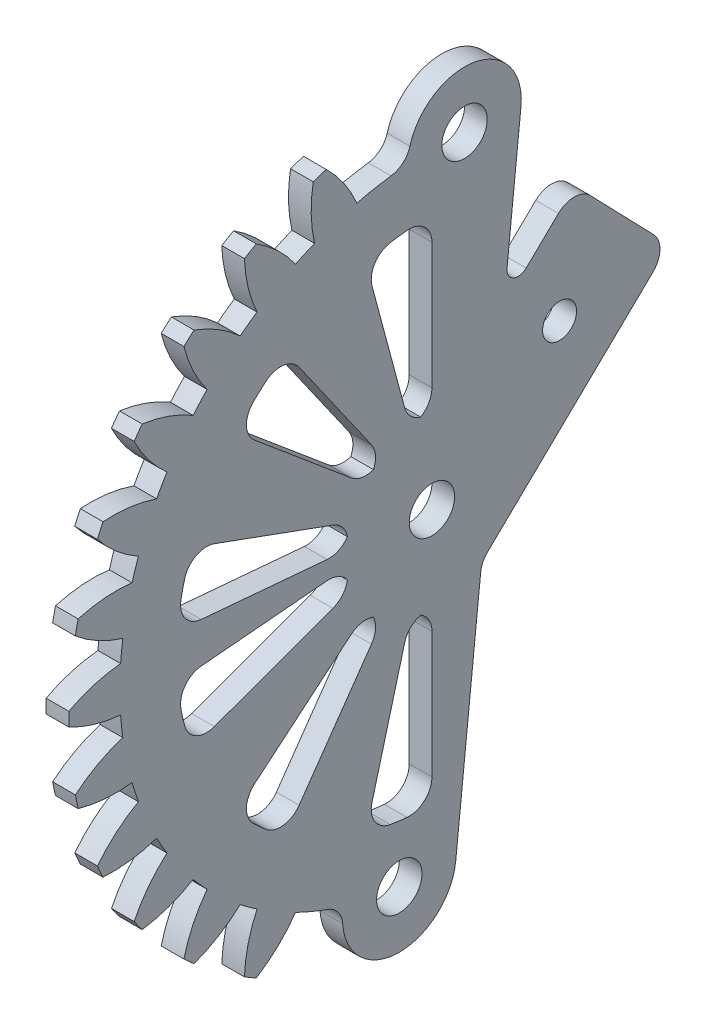
from build123d import *

# Parameters (mm, degrees)
BASPROSKE_W         = 2
BASPROSKE_H         = 32
TOOTHCUT_DEPTH      = 46.299006612
TEETHCUTS_COUNT     = 30
TEETHCUTS_ANGLE     = 348
BORSKE_R            = 0.4
BORE_DEPTH          = 50.0000508
CUT_EXTRUDE_1_DEPTH = 10
CUT_EXTRUDE_3_DEPTH = 46.215730311
EXTRUDE_1_DEPTH     = 2
SKETCH_5_R          = 2
CUT_EXTRUDE_4_DEPTH = 10
EXTRUDE_START       = -2
EXTRUDE_2_DEPTH     = 2
SKETCH_8_R          = 2
CUT_EXTRUDE_6_DEPTH = 2
SKETCH_9_R          = 1.5
EXTRUDE_3_DEPTH     = 2
FILLET_7_R          = 2
CUT_EXTRUDE_7_DEPTH = 10
FILLET_8_R          = 2
FILLET_9_R          = 1


with BuildPart() as part:
    # BasProSke → Base-Revolve (revolve)
    with BuildSketch(Plane(origin=(0, 0, 0), x_dir=(1, 0, 0), z_dir=(0, 1, 0)), mode=Mode.PRIVATE) as base_revolve_sk:
        with Locations((1, 16)):
            Rectangle(BASPROSKE_W, BASPROSKE_H)
    revolve(base_revolve_sk.sketch.rotate(Axis((-10, 0, 0), (1, 0, 0)), 180), axis=Axis((-10, 0, 0), (1, 0, 0)))

    # TooCutSke → ToothCut (cut, through all)
    with BuildSketch(Plane(origin=(0, 0, 0), x_dir=(0, 0, -1), z_dir=(1, 0, 0))):
        with BuildLine():
            ThreePointArc((0.918551563, 27.483654488), (0, 27.499), (-0.918551563, 27.483654488))
            ThreePointArc((-0.918551563, 27.483654488), (-1.617208176, 29.787801627), (-2.761784709, 31.906093311))
            ThreePointArc((-2.761784709, 31.906093311), (0, 32.0254), (2.761784709, 31.906093311))
            ThreePointArc((2.761784709, 31.906093311), (1.617208176, 29.787801627), (0.918551563, 27.483654488))
        make_face()
    toothcut = extrude(amount=TOOTHCUT_DEPTH, mode=Mode.SUBTRACT)

    # TeethCuts: ToothCut ×30 about axis
    teethcuts_axis = Axis((-10, 0, 0), (1, 0, 0))
    for i in range(1, TEETHCUTS_COUNT):
        add(toothcut.rotate(teethcuts_axis, i * TEETHCUTS_ANGLE / (TEETHCUTS_COUNT - 1)), mode=Mode.SUBTRACT)

    # BorSke → Bore (cut, symmetric)
    with BuildSketch(Plane(origin=(0, 0, 0), x_dir=(0, 0, -1), z_dir=(1, 0, 0))):
        with Locations(Location((0, 0, 0), (0, 0, 180))):
            Circle(BORSKE_R)
    extrude(amount=BORE_DEPTH, both=True, mode=Mode.SUBTRACT)

    # 草图1 → 切除-拉伸1 (cut)
    with BuildSketch(Plane(origin=(2, 0, 0), x_dir=(0, 0, -1), z_dir=(1, 0, 0))):
        Polygon((3.344910825, 31.824700652), (-3.960111671, -37.677945718), (64.810502564, -34.553326749), (47.008100667, 53.868547869), (5.993727235, 38.229973826), align=None)
    extrude(amount=-CUT_EXTRUDE_1_DEPTH, mode=Mode.SUBTRACT)

    # 草图2 → 切除-拉伸3 (cut, through all)
    with BuildSketch(Plane(origin=(2, 0, 0), x_dir=(0, 0, -1), z_dir=(1, 0, 0))):
        with BuildLine():
            Line((4.939512658, 27.051732213), (6.979218814, 36.725980442))
            Line((6.979218814, 36.725980442), (-6.447162529, 36.725980442))
            Line((-6.447162529, 36.725980442), (-5.501449664, 26.943070586))
            ThreePointArc((-5.501449664, 26.943070586), (-0.286173264, 27.497510903), (4.939512658, 27.051732213))
        make_face()
        with BuildLine():
            Line((-11.106203944, -25.156455135), (-12.164876938, -35.534369935))
            Line((-12.164876938, -35.534369935), (-0.063712698, -31.064954068))
            Line((-0.063712698, -31.064954068), (0, -27.499))
            ThreePointArc((0, -27.499), (-5.675281546, -26.906991292), (-11.106203944, -25.156455135))
        make_face()
    extrude(amount=-CUT_EXTRUDE_3_DEPTH, mode=Mode.SUBTRACT)

    # 草图4 → 凸台-拉伸1 (add)
    with BuildSketch(Plane(origin=(2, 0, 0), x_dir=(0, 0, -1), z_dir=(1, 0, 0))):
        Polygon((2.874428211, 27.348357601), (-2.874428211, -27.348357601), (2.098181265, -27.870999917), (7.847037688, 26.825715284), align=None)
    extrude(amount=-EXTRUDE_1_DEPTH)

    # 草图5 → 切除-拉伸4 (cut)
    with BuildSketch(Plane(origin=(2, 0, 0), x_dir=(0, 0, -1), z_dir=(1, 0, 0))):
        Circle(SKETCH_5_R)
    extrude(amount=-CUT_EXTRUDE_4_DEPTH, mode=Mode.SUBTRACT)

    # 草图6 → 凸台-拉伸2 (add)
    with BuildSketch(Plane(origin=(2, 0, 0), x_dir=(0, 0, -1), z_dir=(1, 0, 0)).offset(EXTRUDE_START)):
        with BuildLine():
            Line((2.874428211, 27.348357601), (7.847037688, 26.825715284))
            ThreePointArc((7.847037688, 26.825715284), (3.170258871, 32.33959835), (-2.125103827, 27.416763754))
            ThreePointArc((-2.125103827, 27.416763754), (0.37622016, 27.496426302), (2.874428211, 27.348357601))
        make_face()
        with BuildLine():
            Line((-2.874428211, -27.348357601), (2.098181265, -27.870999917))
            ThreePointArc((2.098181265, -27.870999917), (-3.622799465, -32.292034417), (-7.778930918, -26.375807756))
            ThreePointArc((-7.778930918, -26.375807756), (-5.348829637, -26.973783986), (-2.874428211, -27.348357601))
        make_face()
    extrude(amount=EXTRUDE_2_DEPTH)

    # 草图8 → 切除-拉伸6 (cut)
    with BuildSketch(Plane(origin=(2, 0, 0), x_dir=(0, 0, -1), z_dir=(1, 0, 0))):
        with Locations((2.87453274, 27.349352123)):
            Circle(SKETCH_8_R)
        with Locations(Location((-2.87453274, -27.349352123, 0), (0, 0, 180))):
            Circle(SKETCH_8_R)
    extrude(amount=-CUT_EXTRUDE_6_DEPTH, mode=Mode.SUBTRACT)

    # 草图9 → 凸台-拉伸3 (add)
    with BuildSketch(Plane(origin=(2, 0, 0), x_dir=(0, 0, -1), z_dir=(1, 0, 0))):
        Polygon((4.375839678, -6.200527675), (20.920655086, 9.776614846), (12.584754641, 18.40869245), (6.327248729, 12.365889233), align=None)
        with Locations((11.248994031, 8.777781877)):
            Circle(SKETCH_9_R, mode=Mode.SUBTRACT)
    extrude(amount=-EXTRUDE_3_DEPTH)

    # 圆角7
    fillet_7_edges = [part.edges().sort_by_distance(p)[0] for p in [
        (1, 27.416763754, 2.125103827),
        (1, -26.375807756, 7.778930918),
        (1, -6.200527675, -4.375839678),
        (1, 18.40869245, -12.584754641),
        (1, 9.776614846, -20.920655086),
    ]]
    fillet(fillet_7_edges, radius=FILLET_7_R)

    # 草图10 → 切除-拉伸7 (cut)
    with BuildSketch(Plane(origin=(2, 0, 0), x_dir=(0, 0, -1), z_dir=(1, 0, 0))):
        with BuildLine():
            Line((0, 22.5), (0, 7.5))
            ThreePointArc((0, 7.5), (-0.978946442, 7.43583646), (-1.941142838, 7.244443697))
            Line((-1.941142838, 7.244443697), (-5.823428515, 21.733331092))
            ThreePointArc((-5.823428515, 21.733331092), (-2.936839325, 22.307509381), (0, 22.5))
        make_face()
        with BuildLine():
            Line((-1.941142838, -7.244443697), (-5.823428515, -21.733331092))
            ThreePointArc((-5.823428515, -21.733331092), (-2.936839325, -22.307509381), (0, -22.5))
            Line((0, -22.5), (0, -7.5))
            ThreePointArc((0, -7.5), (-0.978946442, -7.43583646), (-1.941142838, -7.244443697))
        make_face()
        with BuildLine():
            Line((-4.301823273, -6.143640332), (-12.905469818, -18.430920997))
            ThreePointArc((-12.905469818, -18.430920997), (-15.200779671, -16.588740078), (-17.23599997, -14.462721218))
            Line((-17.23599997, -14.462721218), (-5.745333323, -4.820907073))
            ThreePointArc((-5.745333323, -4.820907073), (-5.066926557, -5.529580026), (-4.301823273, -6.143640332))
        make_face()
        with BuildLine():
            Line((-7.047694656, -2.565151075), (-21.143083968, -7.695453225))
            ThreePointArc((-21.143083968, -7.695453225), (-21.96666016, -4.869891314), (-22.414380707, -1.961004212))
            Line((-22.414380707, -1.961004212), (-7.471460236, -0.653668071))
            ThreePointArc((-7.471460236, -0.653668071), (-7.322220053, -1.623297105), (-7.047694656, -2.565151075))
        make_face()
        with BuildLine():
            Line((-7.471460236, 0.653668071), (-22.414380707, 1.961004212))
            ThreePointArc((-22.414380707, 1.961004212), (-21.96666016, 4.869891314), (-21.143083968, 7.695453225))
            Line((-21.143083968, 7.695453225), (-7.047694656, 2.565151075))
            ThreePointArc((-7.047694656, 2.565151075), (-7.322220053, 1.623297105), (-7.471460236, 0.653668071))
        make_face()
        with BuildLine():
            Line((-5.745333323, 4.820907073), (-17.23599997, 14.462721218))
            ThreePointArc((-17.23599997, 14.462721218), (-15.200779671, 16.588740078), (-12.905469818, 18.430920997))
            Line((-12.905469818, 18.430920997), (-4.301823273, 6.143640332))
            ThreePointArc((-4.301823273, 6.143640332), (-5.066926557, 5.529580026), (-5.745333323, 4.820907073))
        make_face()
    extrude(amount=-CUT_EXTRUDE_7_DEPTH, mode=Mode.SUBTRACT)

    # 圆角8
    # the kernel refuses this fillet: 2 mm, written as the material it adds along each edge
    with BuildSketch(Plane(origin=(2, 21.733331092, 5.823428515), x_dir=(0, -0.9659258262890681, -0.2588190451025213), z_dir=(-1, 0, 0)), Plane(origin=(2, -7.695453225, 21.143083968), x_dir=(0, 0.3420201433256658, -0.9396926207859094), z_dir=(-1, 0, 0)), Plane(origin=(2, -18.430920997, 12.905469818), x_dir=(0, 0.8191520442889906, -0.5735764363510477), z_dir=(-1, 0, 0)), Plane(origin=(2, -22.5, 0), x_dir=(0, 1, 0), z_dir=(-1, 0, 0)), Plane(origin=(2, 14.462721218, 17.23599997), x_dir=(0, -0.6427876096865373, -0.7660444431189798), z_dir=(-1, 0, 0))) as fillet_8_piece_1:
        with BuildLine():
            CenterArc((2.097794237, -2), FILLET_8_R, 90, 95.598737816)
            ThreePointArc((0.107335138, -2.195121951), (0.026849805, -1.098872287), (0, 0))
            Line((0, 0), (2.097794237, 0))
        make_face()
    extrude(amount=2)
    with BuildSketch(Plane(origin=(2, 7.5, 0), x_dir=(0, 1, 0), z_dir=(-1, 0, 0)), Plane(origin=(2, -0.653668071, 7.471460236), x_dir=(0, -0.08715574274765506, 0.9961946980917458), z_dir=(-1, 0, 0)), Plane(origin=(2, -7.244443697, 1.941142838), x_dir=(0, -0.9659258262890681, 0.25881904510252146), z_dir=(-1, 0, 0)), Plane(origin=(2, 2.565151075, 7.047694656), x_dir=(0, 0.3420201433256657, 0.9396926207859094), z_dir=(-1, 0, 0))) as fillet_8_piece_2:
        with BuildLine():
            CenterArc((1.787087811, -2), FILLET_8_R, 90, 77.846802531)
            ThreePointArc((-0.168088571, -1.578947368), (-0.042140531, -0.793934594), (0, 0))
            Line((0, 0), (1.787087811, 0))
        make_face()
    extrude(amount=2)
    with BuildSketch(Plane(origin=(2, 7.244443697, 1.941142838), x_dir=(0, 0.15511388497476047, -0.9878965951394088), z_dir=(-1, 0, 0)), Plane(origin=(2, -2.565151075, 7.047694656), x_dir=(0, 0.9706182844853172, 0.2406244913195247), z_dir=(-1, 0, 0)), Plane(origin=(2, -6.143640332, 4.301823273), x_dir=(0, 0.6570674137305863, 0.7538318206426409), z_dir=(-1, 0, 0)), Plane(origin=(2, -7.5, 0), x_dir=(0, 0.10585794590086138, 0.9943812625395002), z_dir=(-1, 0, 0)), Plane(origin=(2, 4.820907073, 5.745333323), x_dir=(0, 0.6936960644980776, -0.7202678460821911), z_dir=(-1, 0, 0)), Plane(origin=(2, 0.653668071, 7.471460236), x_dir=(0, 0.9813712137228957, -0.1921211619683022), z_dir=(-1, 0, 0))) as fillet_8_piece_3:
        with BuildLine():
            CenterArc((1.79958508, -1.988762525), FILLET_8_R, 96.076598735, 77.846802531)
            Line((-0.189177445, -1.777046633), (0, 0))
            ThreePointArc((0, 0), (0.793934594, -0.042140531), (1.587869189, 0))
        make_face()
    extrude(amount=2)
    with BuildSketch(Plane(origin=(2, -1.961004212, 22.414380707), x_dir=(0, 0.08715574274765493, -0.9961946980917459), z_dir=(-1, 0, 0)), Plane(origin=(2, -21.733331092, 5.823428515), x_dir=(0, 0.9659258262890682, -0.2588190451025213), z_dir=(-1, 0, 0)), Plane(origin=(2, 22.5, 0), x_dir=(0, -1, 0), z_dir=(-1, 0, 0))) as fillet_8_piece_4:
        with BuildLine():
            CenterArc((2.097794237, 2), FILLET_8_R, 174.401262184, 95.598737816)
            ThreePointArc((0.107335138, 2.195121951), (0.026849805, 1.098872287), (0, 0))
            Line((0, 0), (2.097794237, 0))
        make_face()
    extrude(amount=2)
    with BuildSketch(Plane(origin=(2, -14.462721218, 17.23599997), x_dir=(0, -0.7337373482538164, -0.6794332224563776), z_dir=(-1, 0, 0)), Plane(origin=(2, 18.430920997, 12.905469818), x_dir=(0, -0.6128983503496758, 0.7901617632729682), z_dir=(-1, 0, 0)), Plane(origin=(2, 7.695453225, 21.143083968), x_dir=(0, -0.9552751049492566, 0.29571857206504093), z_dir=(-1, 0, 0))) as fillet_8_piece_5:
        with BuildLine():
            CenterArc((2.100067037, -1.997613351), FILLET_8_R, 87.200631092, 95.598737816)
            Line((0.102453687, -2.095290887), (0, 0))
            ThreePointArc((0, 0), (1.098872287, 0.026849805), (2.197744574, 0))
        make_face()
    extrude(amount=2)
    with BuildSketch(Plane(origin=(2, -4.820907073, 5.745333323), x_dir=(0, -0.693696064498077, -0.7202678460821916), z_dir=(-1, 0, 0)), Plane(origin=(2, 6.143640332, 4.301823273), x_dir=(0, -0.6570674137305856, 0.7538318206426414), z_dir=(-1, 0, 0))) as fillet_8_piece_6:
        with BuildLine():
            CenterArc((1.79958508, 1.988762525), FILLET_8_R, 186.076598735, 77.846802531)
            Line((-0.189177445, 1.777046633), (0, 0))
            ThreePointArc((0, 0), (0.793934594, 0.042140531), (1.587869189, 0))
        make_face()
    extrude(amount=2)
    with BuildSketch(Plane(origin=(2, 1.961004212, 22.414380707), x_dir=(0, 0.9907493352683345, -0.1357046597039071), z_dir=(-1, 0, 0))) as fillet_8_piece_7:
        with BuildLine():
            CenterArc((2.100067037, 1.997613351), FILLET_8_R, 177.200631092, 95.598737816)
            Line((0.102453687, 2.095290887), (0, 0))
            ThreePointArc((0, 0), (1.098872287, -0.026849805), (2.197744574, 0))
        make_face()
    extrude(amount=2)

    # 圆角9
    fillet_9_edges = [part.edges().sort_by_distance(p)[0] for p in [
        (1, 12.365889233, -6.327248729),
    ]]
    fillet(fillet_9_edges, radius=FILLET_9_R)


solid = part.part
